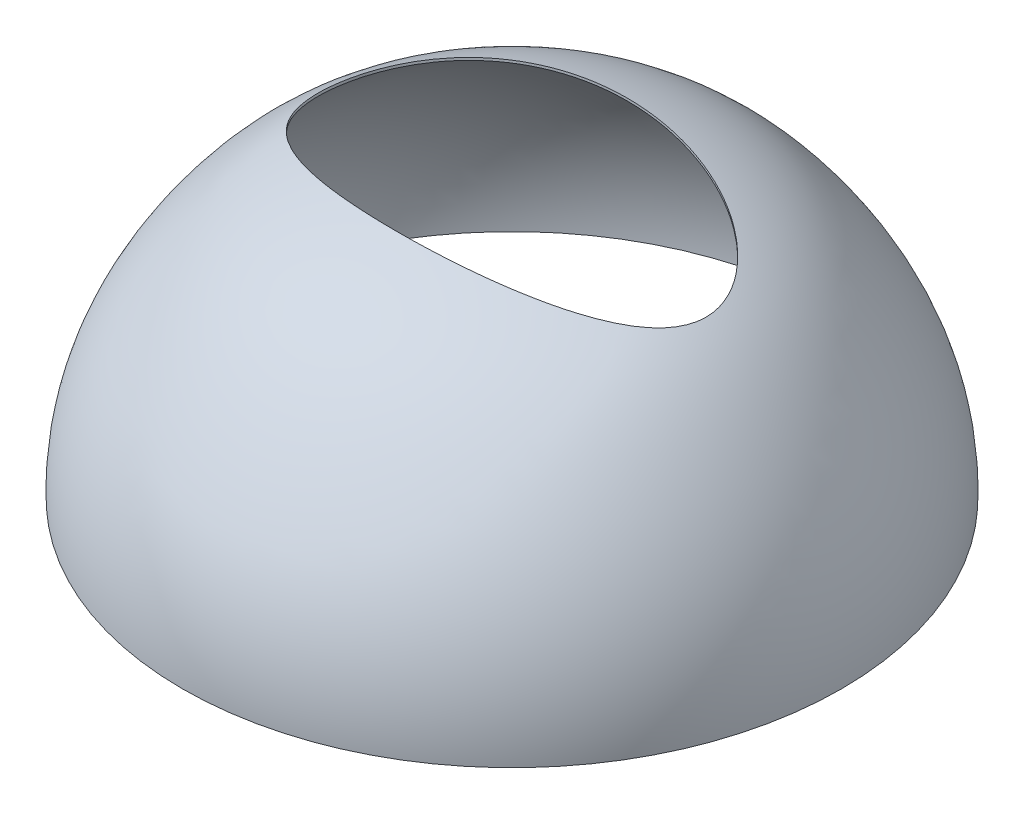
from build123d import *

# Parameters (mm, degrees)
ROTATION_D_NN1_OUTLINE_W        = 0.113188128
ROTATION_D_NN1_OUTLINE_H        = 1
ROTATION_D_NN1_OUTLINE_W_2      = 29.886811872
SKIZZE2_RX                      = 82.455867631
SKIZZE2_RY                      = 49.027813186
SCHNITT_LINEAR_AUSTRAGEN1_DEPTH = 202
ROTATION2_ANGLE                 = 3


# Read off the part's stored shape, not the designer's step: Rotation-Dünn1
with BuildPart() as part:
    # Rotation-Dünn1 outline → Rotation-Dünn1 (revolve)
    with BuildSketch(Plane.XY):
        with BuildLine():
            Line((30, 127), (29.886811872, 127))
            add(Edge.make_bspline(
                [(29.886811872, 127), (29.924538025, 126.991342103), (29.962267412, 126.982676498), (30, 126.97400316)],
                knots=[0, 0, 0, 0, 0.000648386, 0.000648386, 0.000648386, 0.000648386], degree=3))
            Line((30, 126.97400316), (30, 127))
        make_face()
        with Locations((29.943405936, 127.5)):
            Rectangle(ROTATION_D_NN1_OUTLINE_W, ROTATION_D_NN1_OUTLINE_H)
        with Locations((14.943405936, 127.5)):
            Rectangle(ROTATION_D_NN1_OUTLINE_W_2, ROTATION_D_NN1_OUTLINE_H)
        with BuildLine():
            Line((30, 127), (30, 126.97400316))
            add(Edge.make_bspline(
                [(30, 126.97400316), (44.510930435, 123.638472658), (59.495176103, 119.159470388), (76.380216283, 110.552780869), (79.671165399, 108.677112642), (84.422549965, 105.608187262), (85.975511888, 104.542641875), (89.012296056, 102.321504936), (90.49517076, 101.165037475), (97.739385685, 95.156031588), (102.99272173, 89.639702729), (109.009496988, 82.247417665), (110.185400974, 80.744102894), (112.48523463, 77.697900025), (113.608562564, 76.155497402), (116.893290722, 71.472522119), (118.969431326, 68.276183218), (124.813040843, 58.481166274), (128.195628137, 51.67655385), (135.731724357, 32.424575519), (138.61688744, 19.516320947), (139.000412177, 6.138810058)],
                knots=[0.000648386, 0.000648386, 0.000648386, 0.000648386, 0.25, 0.25, 0.3125, 0.3125, 0.34375, 0.34375, 0.375, 0.375, 0.5, 0.5, 0.53125, 0.53125, 0.5625, 0.5625, 0.625, 0.625, 0.75, 0.75, 0.967115187, 0.967115187, 0.967115187, 0.967115187], degree=3))
            Line((139.000412177, 6.138810058), (139.000412177, 18.082835303))
            add(Edge.make_bspline(
                [(34.231854255, 127), (53.794868782, 122.23046394), (84.406099271, 111.53658079), (121.145862461, 71.531144113), (135.852614284, 40.724022307), (139.000412177, 18.082835303)],
                knots=[0.024087618, 0.024087618, 0.024087618, 0.024087618, 0.357284479, 0.530346239, 0.902596657, 0.902596657, 0.902596657, 0.902596657], degree=3))
            Line((34.231854255, 127), (30, 127))
        make_face()
        with BuildLine():
            Line((30, 128), (30, 127))
            Line((30, 127), (34.231854255, 127))
            add(Edge.make_bspline(
                [(30, 128), (31.406389392, 127.677746239), (32.817595948, 127.344801461), (34.231854255, 127)],
                knots=[0, 0, 0, 0, 0.024087618, 0.024087618, 0.024087618, 0.024087618], degree=3))
        make_face()
        with BuildLine():
            Line((139.000412177, 18.082835303), (139.000412177, 6.138810058))
            add(Edge.make_bspline(
                [(139.000412177, 6.138810058), (139.0585018, 4.112618545), (139.059201601, 2.075661872), (139.000412177, 0.028708614)],
                knots=[0.967115187, 0.967115187, 0.967115187, 0.967115187, 1, 1, 1, 1], degree=3))
            Line((139.000412177, 0.028708614), (140, 0.028708614))
            Line((140, 0.028708614), (140, 6.165779952))
            add(Edge.make_bspline(
                [(139.000412177, 18.082835303), (139.546235838, 14.156885796), (139.884849944, 10.18249532), (140, 6.165779952)],
                knots=[0.902596657, 0.902596657, 0.902596657, 0.902596657, 0.967144348, 0.967144348, 0.967144348, 0.967144348], degree=3))
        make_face()
        Polygon((140, 0.028708614), (139.000412177, 0.028708614), (140, 0), align=None)
        with BuildLine():
            Line((140, 0.028708614), (140, 0))
            add(Edge.make_bspline(
                [(140.000820677, 0.028708614), (140.000548407, 0.019139294), (140.000274848, 0.009569756), (140, 0)],
                knots=[0.999847789, 0.999847789, 0.999847789, 0.999847789, 1, 1, 1, 1], degree=3))
            Line((140.000820677, 0.028708614), (140, 0.028708614))
        make_face()
        with BuildLine():
            Line((140, 6.165779952), (140, 0.028708614))
            Line((140, 0.028708614), (140.000820677, 0.028708614))
            add(Edge.make_bspline(
                [(140.044228074, 3.081473717), (140.044228082, 2.066428849), (140.029845016, 1.048808097), (140.000820677, 0.028708614)],
                knots=[0.983621934, 0.983621934, 0.983621934, 0.983621934, 0.999847789, 0.999847789, 0.999847789, 0.999847789], degree=3))
            add(Edge.make_bspline(
                [(140, 6.165779952), (140.02939524, 5.140402132), (140.044228066, 4.112266139), (140.044228074, 3.081473717)],
                knots=[0.967144348, 0.967144348, 0.967144348, 0.967144348, 0.983621934, 0.983621934, 0.983621934, 0.983621934], degree=3))
        make_face()
    revolve(axis=Axis((0, 0, 0), (0, 1, 0)))

    # Skizze2 → Schnitt-Linear austragen1 (cut)
    with BuildSketch(Plane(origin=(0, 0, 0), x_dir=(1, 0, 0), z_dir=(0, 1, 0))):
        with Locations(Location((0, 0), (0, 0, 180))):
            Ellipse(SKIZZE2_RX, SKIZZE2_RY)
    extrude(amount=SCHNITT_LINEAR_AUSTRAGEN1_DEPTH, mode=Mode.SUBTRACT)


with BuildPart() as body_2:
    # Skizze3 → Rotation2 (revolve)
    with BuildSketch(Plane.XY):
        with BuildLine():
            Line((114.317680997, -0.063589627), (138.907613279, -0.063589627))
            add(Edge.make_bspline(
                [(138.907613279, -0.063589627), (138.961228599, 2.565543121), (138.943215579, 7.833614393), (138.049395211, 18.301828769), (136.376209287, 26.96866651), (134.737846199, 32.923272774), (134.48392544, 33.806365862)],
                knots=[-0.015781368, -0.015781368, -0.015781368, -0.015781368, 0.112422115, 0.240625597, 0.497032561, 0.541856638, 0.541856638, 0.541856638, 0.541856638], degree=3))
            Line((134.48392544, 33.806365862), (114.317680997, 33.806365862))
            Line((114.317680997, 33.806365862), (114.317680997, -0.063589627))
        make_face()
    revolve(axis=Axis((0, 0, 0), (0, 1, 0)), revolution_arc=ROTATION2_ANGLE)


solid = Compound([part.part, body_2.part])
